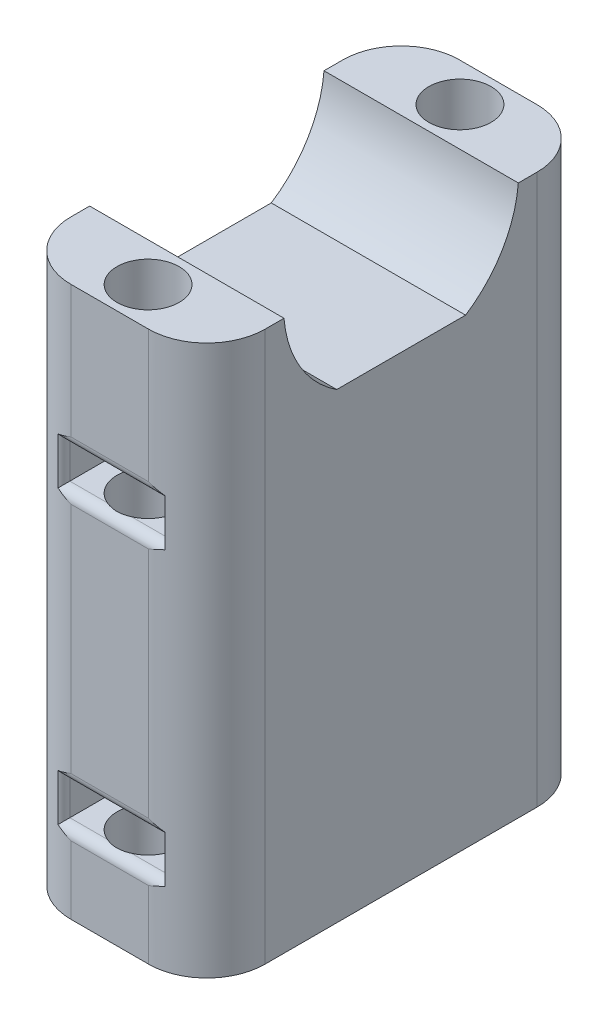
from build123d import *

# Parameters (mm, degrees)
BOSS_EXTRUDE1_DEPTH   = 5
SKETCH2_R             = 1.6
CUT_EXTRUDE1_DEPTH    = 31.894012365
CUT_EXTRUDE2_DEPTH    = 1
MIRROR14_COPY_1_DEPTH = 1
SKETCH5_W             = 20
SKETCH5_H             = 0.5
CUT_EXTRUDE4_DEPTH    = 33.084887408
FILLET2_R             = 0.5
FILLET3_START         = -1
FILLET3_DEPTH         = 29.3


with BuildPart() as part:
    # Sketch1 → Boss-Extrude1 (new, symmetric)
    with BuildSketch(Plane(origin=(0, 0, 0), x_dir=(0, 0, -1), z_dir=(1, 0, 0))):
        with BuildLine():
            Line((10, 0), (-10, 0))
            Line((-10, 0), (-10, 28.8))
            Line((-10, 28.8), (-6.05, 28.8))
            ThreePointArc((-6.05, 28.8), (-5.322096357, 25.935562883), (-3.315, 23.766137169))
            Line((-3.315, 23.766137169), (3.315, 23.766137169))
            ThreePointArc((3.315, 23.766137169), (5.322096357, 25.935562883), (6.05, 28.8))
            Line((6.05, 28.8), (10, 28.8))
            Line((10, 28.8), (10, 0))
        make_face()
    extrude(amount=BOSS_EXTRUDE1_DEPTH, both=True)

    # Sketch2 → Cut-Extrude1 (cut, through all)
    with BuildSketch(Plane(origin=(0, 28.8, 0), x_dir=(1, 0, 0), z_dir=(0, 1, 0))):
        with Locations(Location((0, 8.025, 0), (0, 0, 270))):
            Circle(SKETCH2_R)
        with Locations(Location((0, -8.025, 0), (0, 0, 270))):
            Circle(SKETCH2_R)
    extrude(amount=-CUT_EXTRUDE1_DEPTH, mode=Mode.SUBTRACT)

    # Sketch3 → Cut-Extrude2 (cut, symmetric)
    with BuildSketch(Plane(origin=(0, 20, 0), x_dir=(-1, 0, 0), z_dir=(0, -1, 0))):
        Polygon((0, 5.080513627), (2.55, 6.552756814), (2.55, 10), (-2.55, 10), (-2.55, 6.552756814), align=None)
    cut_extrude2 = extrude(amount=CUT_EXTRUDE2_DEPTH, both=True, mode=Mode.SUBTRACT)

    # Mirror13: Cut-Extrude2 across plane
    add(cut_extrude2.mirror(Plane.XY), mode=Mode.SUBTRACT)

    # Mirror14: Cut-Extrude2 across plane
    add(cut_extrude2.mirror(Plane(origin=(0, 12.5, 0), x_dir=(0, 0, 1), z_dir=(0, -1, 0))), mode=Mode.SUBTRACT)

    # Mirror14 copy 1 sketch → Mirror14 copy 1 (cut, symmetric)
    with BuildSketch(Plane(origin=(0, 5, 0), x_dir=(-1, 0, 0), z_dir=(0, 1, 0))):
        Polygon((0, 5.080513627), (2.55, 6.552756814), (2.55, 10), (-2.55, 10), (-2.55, 6.552756814), align=None)
    extrude(amount=MIRROR14_COPY_1_DEPTH, both=True, mode=Mode.SUBTRACT)

    # Sketch5 → Cut-Extrude4 (cut, through all)
    with BuildSketch(Plane.ZY.offset(5)):
        with Locations((0, 28.55)):
            Rectangle(SKETCH5_W, SKETCH5_H)
    extrude(amount=-CUT_EXTRUDE4_DEPTH, mode=Mode.SUBTRACT)

    # Fillet2
    # the kernel refuses this fillet: 0.5 mm, written as the material it takes off along each edge
    with BuildSketch(Plane(origin=(-2.55, 19, -10), x_dir=(0, -1, 0), z_dir=(1, 0, 0)), Plane(origin=(-2.55, 21, 10), x_dir=(0, 1, 0), z_dir=(1, 0, 0)), Plane(origin=(-2.55, 4, -10), x_dir=(0, -1, 0), z_dir=(1, 0, 0)), Plane(origin=(-2.55, 6, 10), x_dir=(0, 1, 0), z_dir=(1, 0, 0))) as fillet2_piece_1:
        with BuildLine():
            CenterArc((FILLET2_R, -FILLET2_R), FILLET2_R, 90, 90)
            Line((0, -FILLET2_R), (0, 0))
            Line((0, 0), (FILLET2_R, 0))
        make_face()
    extrude(amount=5.1, mode=Mode.SUBTRACT)
    with BuildSketch(Plane(origin=(-2.55, 21, -10), x_dir=(0, 1, 0), z_dir=(1, 0, 0)), Plane(origin=(-2.55, 19, 10), x_dir=(0, -1, 0), z_dir=(1, 0, 0)), Plane(origin=(-2.55, 6, -10), x_dir=(0, 1, 0), z_dir=(1, 0, 0)), Plane(origin=(-2.55, 4, 10), x_dir=(0, -1, 0), z_dir=(1, 0, 0))) as fillet2_piece_2:
        with BuildLine():
            CenterArc((FILLET2_R, FILLET2_R), FILLET2_R, 180, 90)
            Line((0, FILLET2_R), (0, 0))
            Line((0, 0), (FILLET2_R, 0))
        make_face()
    extrude(amount=5.1, mode=Mode.SUBTRACT)
    with BuildSketch(Plane(origin=(2.55, 19, -10), x_dir=(1, 0, 0), z_dir=(0, 1, 0)), Plane(origin=(-2.55, 21, -10), x_dir=(-1, 0, 0), z_dir=(0, -1, 0)), Plane(origin=(2.55, 6, 10), x_dir=(1, 0, 0), z_dir=(0, -1, 0)), Plane(origin=(-2.55, 4, 10), x_dir=(-1, 0, 0), z_dir=(0, 1, 0))) as fillet2_piece_3:
        with BuildLine():
            CenterArc((FILLET2_R, -FILLET2_R), FILLET2_R, 90, 90)
            Line((0, -FILLET2_R), (0, 0))
            Line((0, 0), (FILLET2_R, 0))
        make_face()
    extrude(amount=2, mode=Mode.SUBTRACT)
    with BuildSketch(Plane(origin=(-2.55, 21, 10), x_dir=(-1, 0, 0), z_dir=(0, -1, 0)), Plane(origin=(2.55, 19, 10), x_dir=(1, 0, 0), z_dir=(0, 1, 0)), Plane(origin=(-2.55, 4, -10), x_dir=(-1, 0, 0), z_dir=(0, 1, 0)), Plane(origin=(2.55, 6, -10), x_dir=(1, 0, 0), z_dir=(0, -1, 0))) as fillet2_piece_4:
        with BuildLine():
            CenterArc((FILLET2_R, FILLET2_R), FILLET2_R, 180, 90)
            Line((0, FILLET2_R), (0, 0))
            Line((0, 0), (FILLET2_R, 0))
        make_face()
    extrude(amount=2, mode=Mode.SUBTRACT)
    with BuildSketch(Plane(origin=(-3.8, 19, -10), x_dir=(0, -1, 0), z_dir=(1, 0, 0))) as fillet2_piece_5a_section:
        with BuildLine():
            CenterArc((FILLET2_R, -FILLET2_R), FILLET2_R, 90, 90)
            Line((0, -FILLET2_R), (0, 0))
            Line((0, 0), (FILLET2_R, 0))
        make_face()
    fillet2_piece_5a = extrude(amount=6.35, mode=Mode.PRIVATE)
    fillet2_piece_5a = split(fillet2_piece_5a, bisect_by=Plane(origin=(-2.55, 19, -10), z_dir=(-1, 0, 0)), keep=Keep.TOP, mode=Mode.PRIVATE)
    with BuildSketch(Plane(origin=(-2.55, 21, -10), x_dir=(-1, 0, 0), z_dir=(0, -1, 0))) as fillet2_piece_5b_section:
        with BuildLine():
            CenterArc((FILLET2_R, -FILLET2_R), FILLET2_R, 90, 90)
            Line((0, -FILLET2_R), (0, 0))
            Line((0, 0), (FILLET2_R, 0))
        make_face()
    fillet2_piece_5b = extrude(amount=3.25, mode=Mode.PRIVATE)
    fillet2_piece_5b = split(fillet2_piece_5b, bisect_by=Plane(origin=(-2.55, 19, -10), z_dir=(0, -1, 0)), keep=Keep.TOP, mode=Mode.PRIVATE)
    fillet2_piece_5 = fillet2_piece_5a & fillet2_piece_5b
    add(fillet2_piece_5, mode=Mode.SUBTRACT)
    with BuildSketch(Plane(origin=(2.55, 17.75, -10), x_dir=(1, 0, 0), z_dir=(0, 1, 0))) as fillet2_piece_6a_section:
        with BuildLine():
            CenterArc((FILLET2_R, -FILLET2_R), FILLET2_R, 90, 90)
            Line((0, -FILLET2_R), (0, 0))
            Line((0, 0), (FILLET2_R, 0))
        make_face()
    fillet2_piece_6a = extrude(amount=3.25, mode=Mode.PRIVATE)
    fillet2_piece_6a = split(fillet2_piece_6a, bisect_by=Plane(origin=(2.55, 19, -10), z_dir=(0, -1, 0)), keep=Keep.TOP, mode=Mode.PRIVATE)
    with BuildSketch(Plane(origin=(-2.55, 19, -10), x_dir=(0, -1, 0), z_dir=(1, 0, 0))) as fillet2_piece_6b_section:
        with BuildLine():
            CenterArc((FILLET2_R, -FILLET2_R), FILLET2_R, 90, 90)
            Line((0, -FILLET2_R), (0, 0))
            Line((0, 0), (FILLET2_R, 0))
        make_face()
    fillet2_piece_6b = extrude(amount=6.35, mode=Mode.PRIVATE)
    fillet2_piece_6b = split(fillet2_piece_6b, bisect_by=Plane(origin=(2.55, 19, -10), z_dir=(1, 0, 0)), keep=Keep.TOP, mode=Mode.PRIVATE)
    fillet2_piece_6 = fillet2_piece_6a & fillet2_piece_6b
    add(fillet2_piece_6, mode=Mode.SUBTRACT)
    with BuildSketch(Plane(origin=(-3.8, 21, -10), x_dir=(0, 1, 0), z_dir=(1, 0, 0))) as fillet2_piece_7a_section:
        with BuildLine():
            CenterArc((FILLET2_R, FILLET2_R), FILLET2_R, 180, 90)
            Line((0, FILLET2_R), (0, 0))
            Line((0, 0), (FILLET2_R, 0))
        make_face()
    fillet2_piece_7a = extrude(amount=6.35, mode=Mode.PRIVATE)
    fillet2_piece_7a = split(fillet2_piece_7a, bisect_by=Plane(origin=(-2.55, 21, -10), z_dir=(-1, 0, 0)), keep=Keep.TOP, mode=Mode.PRIVATE)
    with BuildSketch(Plane(origin=(-2.55, 22.25, -10), x_dir=(-1, 0, 0), z_dir=(0, -1, 0))) as fillet2_piece_7b_section:
        with BuildLine():
            CenterArc((FILLET2_R, -FILLET2_R), FILLET2_R, 90, 90)
            Line((0, -FILLET2_R), (0, 0))
            Line((0, 0), (FILLET2_R, 0))
        make_face()
    fillet2_piece_7b = extrude(amount=3.25, mode=Mode.PRIVATE)
    fillet2_piece_7b = split(fillet2_piece_7b, bisect_by=Plane(origin=(-2.55, 21, -10), z_dir=(0, 1, 0)), keep=Keep.TOP, mode=Mode.PRIVATE)
    fillet2_piece_7 = fillet2_piece_7a & fillet2_piece_7b
    add(fillet2_piece_7, mode=Mode.SUBTRACT)
    with BuildSketch(Plane(origin=(2.55, 19, -10), x_dir=(1, 0, 0), z_dir=(0, 1, 0))) as fillet2_piece_8a_section:
        with BuildLine():
            CenterArc((FILLET2_R, -FILLET2_R), FILLET2_R, 90, 90)
            Line((0, -FILLET2_R), (0, 0))
            Line((0, 0), (FILLET2_R, 0))
        make_face()
    fillet2_piece_8a = extrude(amount=3.25, mode=Mode.PRIVATE)
    fillet2_piece_8a = split(fillet2_piece_8a, bisect_by=Plane(origin=(2.55, 21, -10), z_dir=(0, 1, 0)), keep=Keep.TOP, mode=Mode.PRIVATE)
    with BuildSketch(Plane(origin=(-2.55, 21, -10), x_dir=(0, 1, 0), z_dir=(1, 0, 0))) as fillet2_piece_8b_section:
        with BuildLine():
            CenterArc((FILLET2_R, FILLET2_R), FILLET2_R, 180, 90)
            Line((0, FILLET2_R), (0, 0))
            Line((0, 0), (FILLET2_R, 0))
        make_face()
    fillet2_piece_8b = extrude(amount=6.35, mode=Mode.PRIVATE)
    fillet2_piece_8b = split(fillet2_piece_8b, bisect_by=Plane(origin=(2.55, 21, -10), z_dir=(1, 0, 0)), keep=Keep.TOP, mode=Mode.PRIVATE)
    fillet2_piece_8 = fillet2_piece_8a & fillet2_piece_8b
    add(fillet2_piece_8, mode=Mode.SUBTRACT)
    with BuildSketch(Plane(origin=(-2.55, 22.25, 10), x_dir=(-1, 0, 0), z_dir=(0, -1, 0))) as fillet2_piece_9a_section:
        with BuildLine():
            CenterArc((FILLET2_R, FILLET2_R), FILLET2_R, 180, 90)
            Line((0, FILLET2_R), (0, 0))
            Line((0, 0), (FILLET2_R, 0))
        make_face()
    fillet2_piece_9a = extrude(amount=3.25, mode=Mode.PRIVATE)
    fillet2_piece_9a = split(fillet2_piece_9a, bisect_by=Plane(origin=(-2.55, 21, 10), z_dir=(0, 1, 0)), keep=Keep.TOP, mode=Mode.PRIVATE)
    with BuildSketch(Plane(origin=(-3.8, 21, 10), x_dir=(0, 1, 0), z_dir=(1, 0, 0))) as fillet2_piece_9b_section:
        with BuildLine():
            CenterArc((FILLET2_R, -FILLET2_R), FILLET2_R, 90, 90)
            Line((0, -FILLET2_R), (0, 0))
            Line((0, 0), (FILLET2_R, 0))
        make_face()
    fillet2_piece_9b = extrude(amount=6.35, mode=Mode.PRIVATE)
    fillet2_piece_9b = split(fillet2_piece_9b, bisect_by=Plane(origin=(-2.55, 21, 10), z_dir=(-1, 0, 0)), keep=Keep.TOP, mode=Mode.PRIVATE)
    fillet2_piece_9 = fillet2_piece_9a & fillet2_piece_9b
    add(fillet2_piece_9, mode=Mode.SUBTRACT)
    with BuildSketch(Plane(origin=(2.55, 19, 10), x_dir=(1, 0, 0), z_dir=(0, 1, 0))) as fillet2_piece_10a_section:
        with BuildLine():
            CenterArc((FILLET2_R, FILLET2_R), FILLET2_R, 180, 90)
            Line((0, FILLET2_R), (0, 0))
            Line((0, 0), (FILLET2_R, 0))
        make_face()
    fillet2_piece_10a = extrude(amount=3.25, mode=Mode.PRIVATE)
    fillet2_piece_10a = split(fillet2_piece_10a, bisect_by=Plane(origin=(2.55, 21, 10), z_dir=(0, 1, 0)), keep=Keep.TOP, mode=Mode.PRIVATE)
    with BuildSketch(Plane(origin=(-2.55, 21, 10), x_dir=(0, 1, 0), z_dir=(1, 0, 0))) as fillet2_piece_10b_section:
        with BuildLine():
            CenterArc((FILLET2_R, -FILLET2_R), FILLET2_R, 90, 90)
            Line((0, -FILLET2_R), (0, 0))
            Line((0, 0), (FILLET2_R, 0))
        make_face()
    fillet2_piece_10b = extrude(amount=6.35, mode=Mode.PRIVATE)
    fillet2_piece_10b = split(fillet2_piece_10b, bisect_by=Plane(origin=(2.55, 21, 10), z_dir=(1, 0, 0)), keep=Keep.TOP, mode=Mode.PRIVATE)
    fillet2_piece_10 = fillet2_piece_10a & fillet2_piece_10b
    add(fillet2_piece_10, mode=Mode.SUBTRACT)
    with BuildSketch(Plane(origin=(-3.8, 19, 10), x_dir=(0, -1, 0), z_dir=(1, 0, 0))) as fillet2_piece_11a_section:
        with BuildLine():
            CenterArc((FILLET2_R, FILLET2_R), FILLET2_R, 180, 90)
            Line((0, FILLET2_R), (0, 0))
            Line((0, 0), (FILLET2_R, 0))
        make_face()
    fillet2_piece_11a = extrude(amount=6.35, mode=Mode.PRIVATE)
    fillet2_piece_11a = split(fillet2_piece_11a, bisect_by=Plane(origin=(-2.55, 19, 10), z_dir=(-1, 0, 0)), keep=Keep.TOP, mode=Mode.PRIVATE)
    with BuildSketch(Plane(origin=(-2.55, 21, 10), x_dir=(-1, 0, 0), z_dir=(0, -1, 0))) as fillet2_piece_11b_section:
        with BuildLine():
            CenterArc((FILLET2_R, FILLET2_R), FILLET2_R, 180, 90)
            Line((0, FILLET2_R), (0, 0))
            Line((0, 0), (FILLET2_R, 0))
        make_face()
    fillet2_piece_11b = extrude(amount=3.25, mode=Mode.PRIVATE)
    fillet2_piece_11b = split(fillet2_piece_11b, bisect_by=Plane(origin=(-2.55, 19, 10), z_dir=(0, -1, 0)), keep=Keep.TOP, mode=Mode.PRIVATE)
    fillet2_piece_11 = fillet2_piece_11a & fillet2_piece_11b
    add(fillet2_piece_11, mode=Mode.SUBTRACT)
    with BuildSketch(Plane(origin=(-2.55, 19, 10), x_dir=(0, -1, 0), z_dir=(1, 0, 0))) as fillet2_piece_12a_section:
        with BuildLine():
            CenterArc((FILLET2_R, FILLET2_R), FILLET2_R, 180, 90)
            Line((0, FILLET2_R), (0, 0))
            Line((0, 0), (FILLET2_R, 0))
        make_face()
    fillet2_piece_12a = extrude(amount=6.35, mode=Mode.PRIVATE)
    fillet2_piece_12a = split(fillet2_piece_12a, bisect_by=Plane(origin=(2.55, 19, 10), z_dir=(1, 0, 0)), keep=Keep.TOP, mode=Mode.PRIVATE)
    with BuildSketch(Plane(origin=(2.55, 17.75, 10), x_dir=(1, 0, 0), z_dir=(0, 1, 0))) as fillet2_piece_12b_section:
        with BuildLine():
            CenterArc((FILLET2_R, FILLET2_R), FILLET2_R, 180, 90)
            Line((0, FILLET2_R), (0, 0))
            Line((0, 0), (FILLET2_R, 0))
        make_face()
    fillet2_piece_12b = extrude(amount=3.25, mode=Mode.PRIVATE)
    fillet2_piece_12b = split(fillet2_piece_12b, bisect_by=Plane(origin=(2.55, 19, 10), z_dir=(0, -1, 0)), keep=Keep.TOP, mode=Mode.PRIVATE)
    fillet2_piece_12 = fillet2_piece_12a & fillet2_piece_12b
    add(fillet2_piece_12, mode=Mode.SUBTRACT)
    with BuildSketch(Plane(origin=(-2.55, 2.75, -10), x_dir=(-1, 0, 0), z_dir=(0, 1, 0))) as fillet2_piece_13a_section:
        with BuildLine():
            CenterArc((FILLET2_R, FILLET2_R), FILLET2_R, 180, 90)
            Line((0, FILLET2_R), (0, 0))
            Line((0, 0), (FILLET2_R, 0))
        make_face()
    fillet2_piece_13a = extrude(amount=3.25, mode=Mode.PRIVATE)
    fillet2_piece_13a = split(fillet2_piece_13a, bisect_by=Plane(origin=(-2.55, 4, -10), z_dir=(0, -1, 0)), keep=Keep.TOP, mode=Mode.PRIVATE)
    with BuildSketch(Plane(origin=(-3.8, 4, -10), x_dir=(0, -1, 0), z_dir=(1, 0, 0))) as fillet2_piece_13b_section:
        with BuildLine():
            CenterArc((FILLET2_R, -FILLET2_R), FILLET2_R, 90, 90)
            Line((0, -FILLET2_R), (0, 0))
            Line((0, 0), (FILLET2_R, 0))
        make_face()
    fillet2_piece_13b = extrude(amount=6.35, mode=Mode.PRIVATE)
    fillet2_piece_13b = split(fillet2_piece_13b, bisect_by=Plane(origin=(-2.55, 4, -10), z_dir=(-1, 0, 0)), keep=Keep.TOP, mode=Mode.PRIVATE)
    fillet2_piece_13 = fillet2_piece_13a & fillet2_piece_13b
    add(fillet2_piece_13, mode=Mode.SUBTRACT)
    with BuildSketch(Plane(origin=(2.55, 6, -10), x_dir=(1, 0, 0), z_dir=(0, -1, 0))) as fillet2_piece_14a_section:
        with BuildLine():
            CenterArc((FILLET2_R, FILLET2_R), FILLET2_R, 180, 90)
            Line((0, FILLET2_R), (0, 0))
            Line((0, 0), (FILLET2_R, 0))
        make_face()
    fillet2_piece_14a = extrude(amount=3.25, mode=Mode.PRIVATE)
    fillet2_piece_14a = split(fillet2_piece_14a, bisect_by=Plane(origin=(2.55, 4, -10), z_dir=(0, -1, 0)), keep=Keep.TOP, mode=Mode.PRIVATE)
    with BuildSketch(Plane(origin=(-2.55, 4, -10), x_dir=(0, -1, 0), z_dir=(1, 0, 0))) as fillet2_piece_14b_section:
        with BuildLine():
            CenterArc((FILLET2_R, -FILLET2_R), FILLET2_R, 90, 90)
            Line((0, -FILLET2_R), (0, 0))
            Line((0, 0), (FILLET2_R, 0))
        make_face()
    fillet2_piece_14b = extrude(amount=6.35, mode=Mode.PRIVATE)
    fillet2_piece_14b = split(fillet2_piece_14b, bisect_by=Plane(origin=(2.55, 4, -10), z_dir=(1, 0, 0)), keep=Keep.TOP, mode=Mode.PRIVATE)
    fillet2_piece_14 = fillet2_piece_14a & fillet2_piece_14b
    add(fillet2_piece_14, mode=Mode.SUBTRACT)
    with BuildSketch(Plane(origin=(-3.8, 6, -10), x_dir=(0, 1, 0), z_dir=(1, 0, 0))) as fillet2_piece_15a_section:
        with BuildLine():
            CenterArc((FILLET2_R, FILLET2_R), FILLET2_R, 180, 90)
            Line((0, FILLET2_R), (0, 0))
            Line((0, 0), (FILLET2_R, 0))
        make_face()
    fillet2_piece_15a = extrude(amount=6.35, mode=Mode.PRIVATE)
    fillet2_piece_15a = split(fillet2_piece_15a, bisect_by=Plane(origin=(-2.55, 6, -10), z_dir=(-1, 0, 0)), keep=Keep.TOP, mode=Mode.PRIVATE)
    with BuildSketch(Plane(origin=(-2.55, 4, -10), x_dir=(-1, 0, 0), z_dir=(0, 1, 0))) as fillet2_piece_15b_section:
        with BuildLine():
            CenterArc((FILLET2_R, FILLET2_R), FILLET2_R, 180, 90)
            Line((0, FILLET2_R), (0, 0))
            Line((0, 0), (FILLET2_R, 0))
        make_face()
    fillet2_piece_15b = extrude(amount=3.25, mode=Mode.PRIVATE)
    fillet2_piece_15b = split(fillet2_piece_15b, bisect_by=Plane(origin=(-2.55, 6, -10), z_dir=(0, 1, 0)), keep=Keep.TOP, mode=Mode.PRIVATE)
    fillet2_piece_15 = fillet2_piece_15a & fillet2_piece_15b
    add(fillet2_piece_15, mode=Mode.SUBTRACT)
    with BuildSketch(Plane(origin=(-2.55, 6, -10), x_dir=(0, 1, 0), z_dir=(1, 0, 0))) as fillet2_piece_16a_section:
        with BuildLine():
            CenterArc((FILLET2_R, FILLET2_R), FILLET2_R, 180, 90)
            Line((0, FILLET2_R), (0, 0))
            Line((0, 0), (FILLET2_R, 0))
        make_face()
    fillet2_piece_16a = extrude(amount=6.35, mode=Mode.PRIVATE)
    fillet2_piece_16a = split(fillet2_piece_16a, bisect_by=Plane(origin=(2.55, 6, -10), z_dir=(1, 0, 0)), keep=Keep.TOP, mode=Mode.PRIVATE)
    with BuildSketch(Plane(origin=(2.55, 7.25, -10), x_dir=(1, 0, 0), z_dir=(0, -1, 0))) as fillet2_piece_16b_section:
        with BuildLine():
            CenterArc((FILLET2_R, FILLET2_R), FILLET2_R, 180, 90)
            Line((0, FILLET2_R), (0, 0))
            Line((0, 0), (FILLET2_R, 0))
        make_face()
    fillet2_piece_16b = extrude(amount=3.25, mode=Mode.PRIVATE)
    fillet2_piece_16b = split(fillet2_piece_16b, bisect_by=Plane(origin=(2.55, 6, -10), z_dir=(0, 1, 0)), keep=Keep.TOP, mode=Mode.PRIVATE)
    fillet2_piece_16 = fillet2_piece_16a & fillet2_piece_16b
    add(fillet2_piece_16, mode=Mode.SUBTRACT)
    with BuildSketch(Plane(origin=(-3.8, 6, 10), x_dir=(0, 1, 0), z_dir=(1, 0, 0))) as fillet2_piece_17a_section:
        with BuildLine():
            CenterArc((FILLET2_R, -FILLET2_R), FILLET2_R, 90, 90)
            Line((0, -FILLET2_R), (0, 0))
            Line((0, 0), (FILLET2_R, 0))
        make_face()
    fillet2_piece_17a = extrude(amount=6.35, mode=Mode.PRIVATE)
    fillet2_piece_17a = split(fillet2_piece_17a, bisect_by=Plane(origin=(-2.55, 6, 10), z_dir=(-1, 0, 0)), keep=Keep.TOP, mode=Mode.PRIVATE)
    with BuildSketch(Plane(origin=(-2.55, 4, 10), x_dir=(-1, 0, 0), z_dir=(0, 1, 0))) as fillet2_piece_17b_section:
        with BuildLine():
            CenterArc((FILLET2_R, -FILLET2_R), FILLET2_R, 90, 90)
            Line((0, -FILLET2_R), (0, 0))
            Line((0, 0), (FILLET2_R, 0))
        make_face()
    fillet2_piece_17b = extrude(amount=3.25, mode=Mode.PRIVATE)
    fillet2_piece_17b = split(fillet2_piece_17b, bisect_by=Plane(origin=(-2.55, 6, 10), z_dir=(0, 1, 0)), keep=Keep.TOP, mode=Mode.PRIVATE)
    fillet2_piece_17 = fillet2_piece_17a & fillet2_piece_17b
    add(fillet2_piece_17, mode=Mode.SUBTRACT)
    with BuildSketch(Plane(origin=(2.55, 7.25, 10), x_dir=(1, 0, 0), z_dir=(0, -1, 0))) as fillet2_piece_18a_section:
        with BuildLine():
            CenterArc((FILLET2_R, -FILLET2_R), FILLET2_R, 90, 90)
            Line((0, -FILLET2_R), (0, 0))
            Line((0, 0), (FILLET2_R, 0))
        make_face()
    fillet2_piece_18a = extrude(amount=3.25, mode=Mode.PRIVATE)
    fillet2_piece_18a = split(fillet2_piece_18a, bisect_by=Plane(origin=(2.55, 6, 10), z_dir=(0, 1, 0)), keep=Keep.TOP, mode=Mode.PRIVATE)
    with BuildSketch(Plane(origin=(-2.55, 6, 10), x_dir=(0, 1, 0), z_dir=(1, 0, 0))) as fillet2_piece_18b_section:
        with BuildLine():
            CenterArc((FILLET2_R, -FILLET2_R), FILLET2_R, 90, 90)
            Line((0, -FILLET2_R), (0, 0))
            Line((0, 0), (FILLET2_R, 0))
        make_face()
    fillet2_piece_18b = extrude(amount=6.35, mode=Mode.PRIVATE)
    fillet2_piece_18b = split(fillet2_piece_18b, bisect_by=Plane(origin=(2.55, 6, 10), z_dir=(1, 0, 0)), keep=Keep.TOP, mode=Mode.PRIVATE)
    fillet2_piece_18 = fillet2_piece_18a & fillet2_piece_18b
    add(fillet2_piece_18, mode=Mode.SUBTRACT)
    with BuildSketch(Plane(origin=(-3.8, 4, 10), x_dir=(0, -1, 0), z_dir=(1, 0, 0))) as fillet2_piece_19a_section:
        with BuildLine():
            CenterArc((FILLET2_R, FILLET2_R), FILLET2_R, 180, 90)
            Line((0, FILLET2_R), (0, 0))
            Line((0, 0), (FILLET2_R, 0))
        make_face()
    fillet2_piece_19a = extrude(amount=6.35, mode=Mode.PRIVATE)
    fillet2_piece_19a = split(fillet2_piece_19a, bisect_by=Plane(origin=(-2.55, 4, 10), z_dir=(-1, 0, 0)), keep=Keep.TOP, mode=Mode.PRIVATE)
    with BuildSketch(Plane(origin=(-2.55, 2.75, 10), x_dir=(-1, 0, 0), z_dir=(0, 1, 0))) as fillet2_piece_19b_section:
        with BuildLine():
            CenterArc((FILLET2_R, -FILLET2_R), FILLET2_R, 90, 90)
            Line((0, -FILLET2_R), (0, 0))
            Line((0, 0), (FILLET2_R, 0))
        make_face()
    fillet2_piece_19b = extrude(amount=3.25, mode=Mode.PRIVATE)
    fillet2_piece_19b = split(fillet2_piece_19b, bisect_by=Plane(origin=(-2.55, 4, 10), z_dir=(0, -1, 0)), keep=Keep.TOP, mode=Mode.PRIVATE)
    fillet2_piece_19 = fillet2_piece_19a & fillet2_piece_19b
    add(fillet2_piece_19, mode=Mode.SUBTRACT)
    with BuildSketch(Plane(origin=(2.55, 6, 10), x_dir=(1, 0, 0), z_dir=(0, -1, 0))) as fillet2_piece_20a_section:
        with BuildLine():
            CenterArc((FILLET2_R, -FILLET2_R), FILLET2_R, 90, 90)
            Line((0, -FILLET2_R), (0, 0))
            Line((0, 0), (FILLET2_R, 0))
        make_face()
    fillet2_piece_20a = extrude(amount=3.25, mode=Mode.PRIVATE)
    fillet2_piece_20a = split(fillet2_piece_20a, bisect_by=Plane(origin=(2.55, 4, 10), z_dir=(0, -1, 0)), keep=Keep.TOP, mode=Mode.PRIVATE)
    with BuildSketch(Plane(origin=(-2.55, 4, 10), x_dir=(0, -1, 0), z_dir=(1, 0, 0))) as fillet2_piece_20b_section:
        with BuildLine():
            CenterArc((FILLET2_R, FILLET2_R), FILLET2_R, 180, 90)
            Line((0, FILLET2_R), (0, 0))
            Line((0, 0), (FILLET2_R, 0))
        make_face()
    fillet2_piece_20b = extrude(amount=6.35, mode=Mode.PRIVATE)
    fillet2_piece_20b = split(fillet2_piece_20b, bisect_by=Plane(origin=(2.55, 4, 10), z_dir=(1, 0, 0)), keep=Keep.TOP, mode=Mode.PRIVATE)
    fillet2_piece_20 = fillet2_piece_20a & fillet2_piece_20b
    add(fillet2_piece_20, mode=Mode.SUBTRACT)

    # Fillet3: read off the stored shape, not the designer's step
    # Fillet3 outline → Fillet3 (cut)
    with BuildSketch(Plane(origin=(0, 0, 0), x_dir=(1, 0, 0), z_dir=(0, 1, 0)).offset(FILLET3_START)):
        with BuildLine():
            ThreePointArc((-2, -10), (-4.121320344, -9.121320344), (-5, -7))
            Line((-5, -7), (-5, -10))
            Line((-5, -10), (-2, -10))
        make_face()
        with BuildLine():
            Line((2, -10), (5, -10))
            Line((5, -10), (5, -7))
            ThreePointArc((5, -7), (4.121320344, -9.121320344), (2, -10))
        make_face()
        with BuildLine():
            Line((-5, 10), (-5, 7))
            ThreePointArc((-5, 7), (-4.121320344, 9.121320344), (-2, 10))
            Line((-2, 10), (-5, 10))
        make_face()
        with BuildLine():
            Line((5, 7), (5, 10))
            Line((5, 10), (2, 10))
            ThreePointArc((2, 10), (4.121320344, 9.121320344), (5, 7))
        make_face()
    extrude(amount=FILLET3_DEPTH, mode=Mode.SUBTRACT)


solid = part.part
